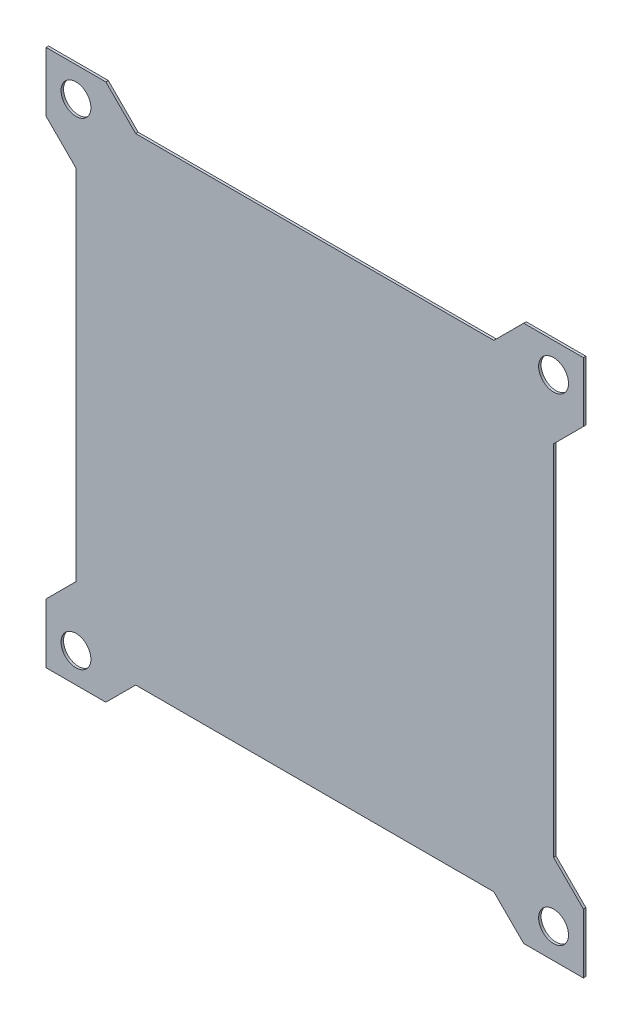
from build123d import *

# Parameters (mm, degrees)
BOARD_DEPTH               = 0.41148
OTW_R_1_0_228_1_OUTLINE_R = 2.5
OTW_R_1_0_228_1_DEPTH     = 0.41148
OTW_R_1_0_228_2_OUTLINE_R = 2.5
OTW_R_1_0_228_2_DEPTH     = 0.41148
OTW_R_1_0_228_3_OUTLINE_R = 2.5
OTW_R_1_0_228_3_DEPTH     = 0.41148
OTW_R_1_0_228_4_OUTLINE_R = 2.5
OTW_R_1_0_228_4_DEPTH     = 0.41148


# Read off the part's stored shape, not the designer's step: Otwór #1 (0.228)1, Otwór #1 (0.228)2, Otwór #1 (0.228)3, Otwór #1 (0.228)4
with BuildPart() as part:
    # Szkic1 → Board (new body)
    with BuildSketch(Plane.XY):
        Polygon((90, 80), (85, 75), (85, 15), (90, 10), (90, 0), (80, 0), (75, 5), (15, 5), (10, 0), (0, 0), (0, 10), (5, 15), (5, 75), (0, 80), (0, 90), (10, 90), (15, 85), (75, 85), (80, 90), (90, 90), align=None)
    extrude(amount=BOARD_DEPTH)

    # Otwór #1 (0.228)1 outline → Otwór #1 (0.228)1 (cut)
    with BuildSketch(Plane.XY):
        with Locations((85, 85)):
            Circle(OTW_R_1_0_228_1_OUTLINE_R)
    extrude(amount=OTW_R_1_0_228_1_DEPTH, mode=Mode.SUBTRACT)

    # Otwór #1 (0.228)2 outline → Otwór #1 (0.228)2 (cut)
    with BuildSketch(Plane.XY):
        with Locations((5, 85)):
            Circle(OTW_R_1_0_228_2_OUTLINE_R)
    extrude(amount=OTW_R_1_0_228_2_DEPTH, mode=Mode.SUBTRACT)

    # Otwór #1 (0.228)3 outline → Otwór #1 (0.228)3 (cut)
    with BuildSketch(Plane.XY):
        with Locations((85, 5)):
            Circle(OTW_R_1_0_228_3_OUTLINE_R)
    extrude(amount=OTW_R_1_0_228_3_DEPTH, mode=Mode.SUBTRACT)

    # Otwór #1 (0.228)4 outline → Otwór #1 (0.228)4 (cut)
    with BuildSketch(Plane.XY):
        with Locations((5, 5)):
            Circle(OTW_R_1_0_228_4_OUTLINE_R)
    extrude(amount=OTW_R_1_0_228_4_DEPTH, mode=Mode.SUBTRACT)


solid = part.part
